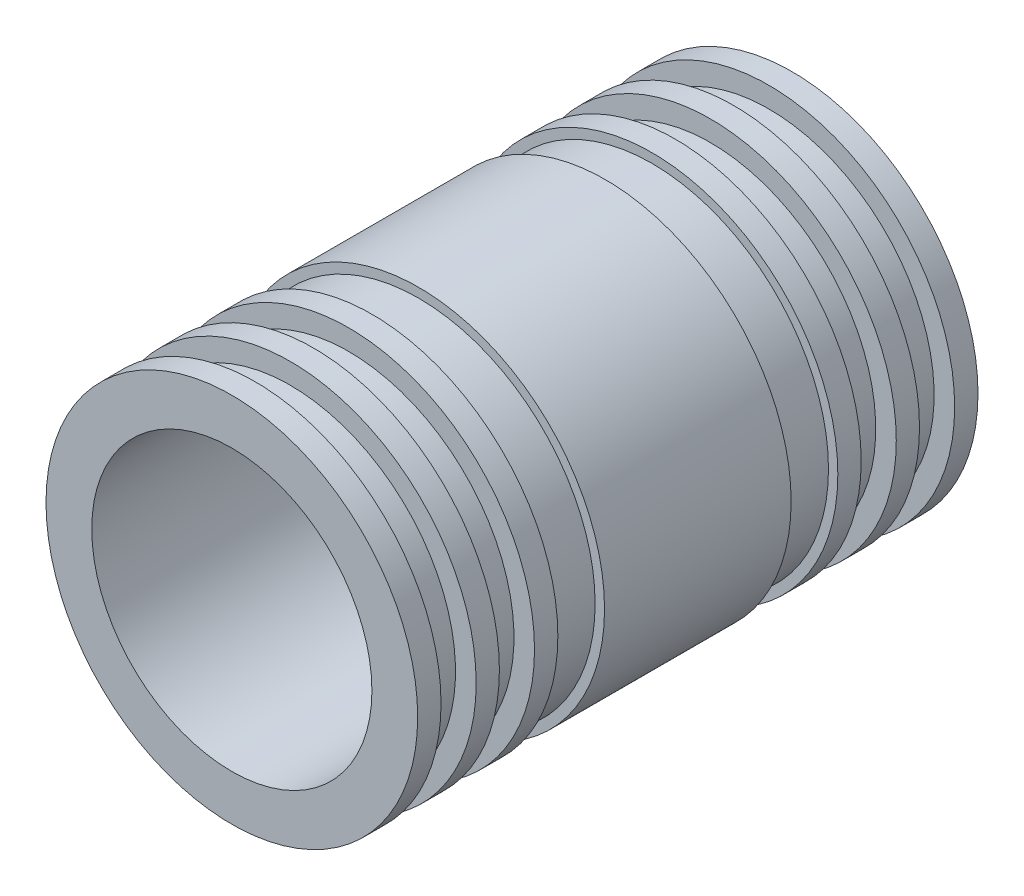
from build123d import *

# Parameters (mm, degrees)
SKETCH1_R           = 25.273
BOSS_EXTRUDE1_DEPTH = 76.2
SKETCH5_R           = 19.05
CUT_EXTRUDE2_DEPTH  = 76.2


with BuildPart() as part:
    # Sketch1 → Boss-Extrude1 (new body)
    with BuildSketch(Plane.XY):
        Circle(SKETCH1_R)
    extrude(amount=BOSS_EXTRUDE1_DEPTH)

    # Sketch5 → Cut-Extrude2 (cut)
    with BuildSketch(Plane.XY.offset(76.2)):
        Circle(SKETCH5_R)
    extrude(amount=-CUT_EXTRUDE2_DEPTH, mode=Mode.SUBTRACT)

    # Cut-Sweep4: sweep along a path in groove path
    with BuildLine(Plane.XY.offset(60.3123)) as cut_sweep4_path:
        CenterArc((0, 0), 25.273, 0, 360)
    # Groove → Cut-Sweep4 (sweep, cut)
    with BuildSketch(Plane(origin=(0, 0, 0), x_dir=(0, 0, -1), z_dir=(1, 0, 0))):
        Polygon((-73.025, 25.273), (-73.025, 22.479), (-68.2625, 22.479), (-68.244704377, 25.273), (-65.0875, 25.273), (-65.0875, 22.479), (-60.3123, 22.479), (-60.3123, 25.273), (-57.1373, 25.273), (-57.1373, 24.003), (-50.8, 24.003), (-50.7873, 25.273), (-50.7873, 27.723939067), (-73.025, 27.723939067), align=None)
        Polygon((-3.175, 27.723939067), (-3.175, 25.273), (-3.175, 22.479), (-7.9375, 22.479), (-7.955295623, 25.273), (-11.1125, 25.273), (-11.1125, 22.479), (-15.8877, 22.479), (-15.8877, 25.273), (-19.0627, 25.273), (-19.0627, 24.003), (-25.4, 24.003), (-25.4127, 25.273), (-25.4127, 27.723939067), align=None)
    sweep(path=cut_sweep4_path.line, mode=Mode.SUBTRACT)


solid = part.part
